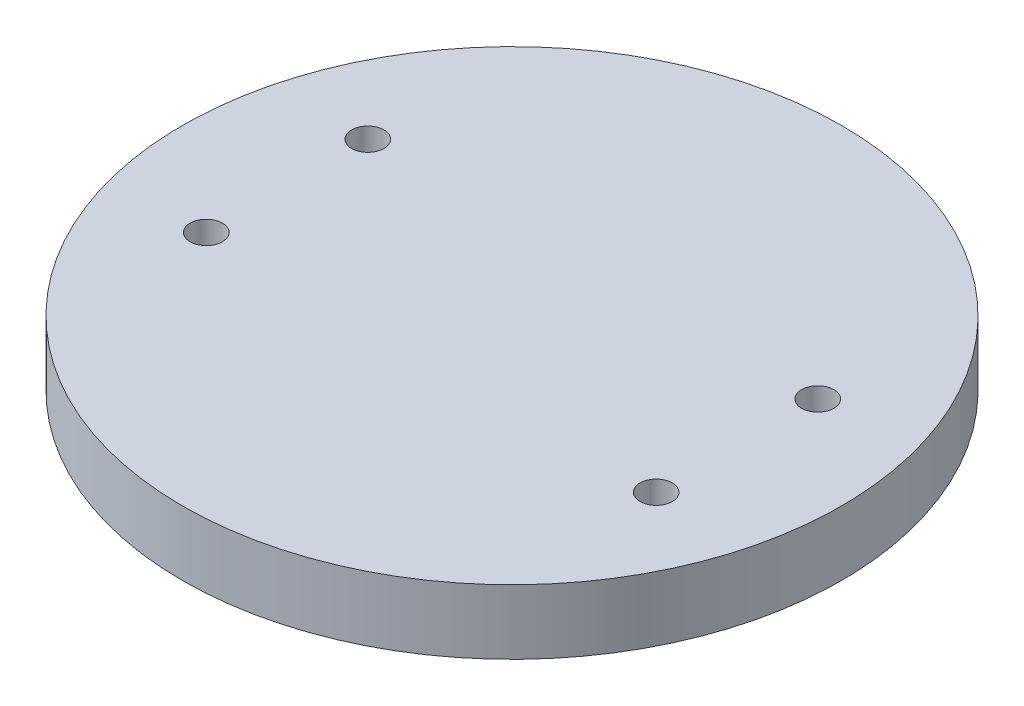
from build123d import *

# Parameters (mm, degrees)
SKETCH1_R           = 64.77
BOSS_EXTRUDE1_DEPTH = 12.7
SKETCH2_R           = 3.175
CUT_EXTRUDE1_DEPTH  = 93.47483874


with BuildPart() as part:
    # Sketch1 → Boss-Extrude1 (new body)
    with BuildSketch(Plane(origin=(0, 0, 0), x_dir=(1, 0, 0), z_dir=(0, 1, 0))):
        Circle(SKETCH1_R)
    extrude(amount=BOSS_EXTRUDE1_DEPTH)

    # Sketch2 → Cut-Extrude1 (cut, through all)
    with BuildSketch(Plane(origin=(0, 12.7, 0), x_dir=(1, 0, 0), z_dir=(0, 1, 0))):
        with Locations((-44.214813621, 15.875)):
            Circle(SKETCH2_R)
        with Locations((-44.214813621, -15.875)):
            Circle(SKETCH2_R)
        with Locations((44.214813621, -15.875)):
            Circle(SKETCH2_R)
        with Locations((44.214813621, 15.875)):
            Circle(SKETCH2_R)
    extrude(amount=-CUT_EXTRUDE1_DEPTH, mode=Mode.SUBTRACT)


solid = part.part
